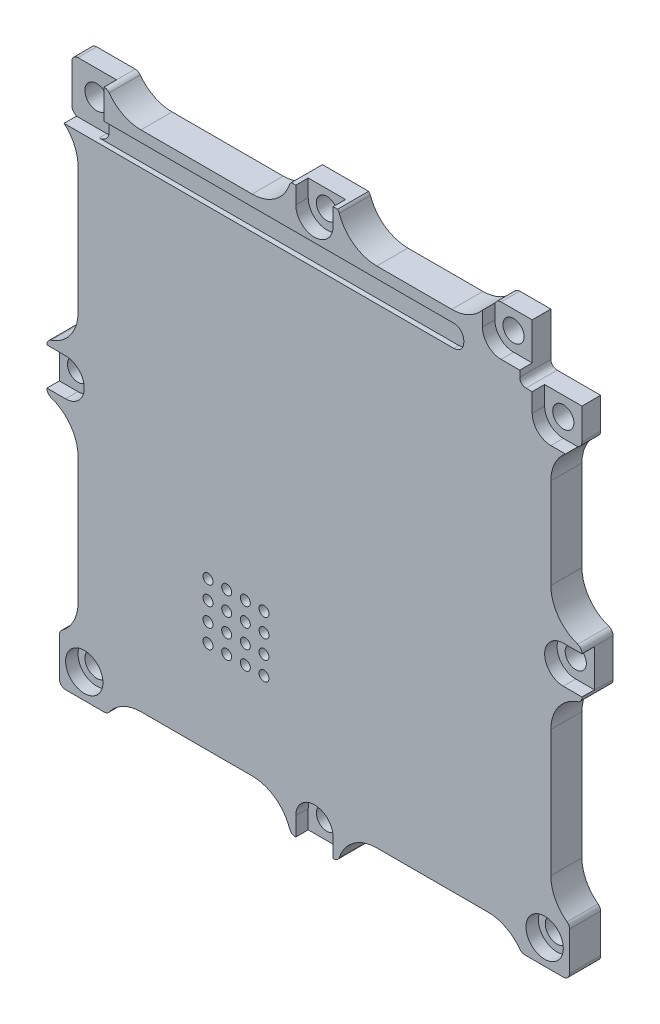
from build123d import *

# Parameters (mm, degrees)
SKETCH1_R           = 1.7
BOSS_EXTRUDE1_DEPTH = 5
CUT_EXTRUDE1_DEPTH  = 2
SKETCH3_R           = 3
CUT_EXTRUDE2_DEPTH  = 2
SKETCH4_R           = 1.9
CUT_EXTRUDE3_DEPTH  = 3
SKETCH5_R           = 0.8
CUT_EXTRUDE4_DEPTH  = 3
CUT_EXTRUDE8_DEPTH  = 0.8
FILLET1_R           = 1.5875
CUT_EXTRUDE9_REACH  = 64.803
SKETCH8_W           = 7.193942136
SKETCH8_H           = 8.27
FILLET2_R           = 1.5875
SKETCH9_W           = 5
SKETCH9_H           = 0.25
CUT_EXTRUDE11_DEPTH = 5


with BuildPart() as part:
    # Sketch1 → Boss-Extrude1 (new body)
    with BuildSketch(Plane.XY):
        with BuildLine():
            Line((43, -3.052490593), (43, 3.052490593))
            ThreePointArc((43, 3.052490593), (42.8123201, 3.635702437), (42.319727891, 4))
            ThreePointArc((42.319727891, 4), (39.191767362, 6.313289526), (38, 10.016684732))
            Line((38, 10.016684732), (38, 24.575474703))
            ThreePointArc((38, 24.575474703), (38.684894673, 27.444112294), (40.591836735, 29.693942136))
            ThreePointArc((40.591836735, 29.693942136), (40.892142571, 30.048246049), (41, 30.5))
            Line((41, 30.5), (41, 35.5))
            Line((41, 35.5), (34, 35.5))
            ThreePointArc((34, 35.5), (33.292893219, 35.792893219), (33, 36.5))
            Line((33, 36.5), (33, 43.5))
            Line((33, 43.5), (28, 43.5))
            ThreePointArc((28, 43.5), (27.548246049, 43.392142571), (27.193942136, 43.091836735))
            ThreePointArc((27.193942136, 43.091836735), (24.944112294, 41.184894673), (22.075474703, 40.5))
            Line((22.075474703, 40.5), (10.016684732, 40.5))
            ThreePointArc((10.016684732, 40.5), (6.313289526, 41.691767362), (4, 44.819727891))
            ThreePointArc((4, 44.819727891), (3.635702437, 45.3123201), (3.052490593, 45.5))
            Line((3.052490593, 45.5), (-3.052490593, 45.5))
            ThreePointArc((-3.052490593, 45.5), (-3.635702437, 45.3123201), (-4, 44.819727891))
            ThreePointArc((-4, 44.819727891), (-6.313289526, 41.691767362), (-10.016684732, 40.5))
            Line((-10.016684732, 40.5), (-27.881532566, 40.5))
            ThreePointArc((-27.881532566, 40.5), (-30.750170158, 41.184894673), (-33, 43.091836735))
            ThreePointArc((-33, 43.091836735), (-33.354303912, 43.392142571), (-33.806057864, 43.5))
            Line((-33.806057864, 43.5), (-40, 43.5))
            ThreePointArc((-40, 43.5), (-40.707106781, 43.207106781), (-41, 42.5))
            Line((-41, 42.5), (-41, 36.306057864))
            ThreePointArc((-41, 36.306057864), (-40.892142571, 35.854303912), (-40.591836735, 35.5))
            ThreePointArc((-40.591836735, 35.5), (-38.684894673, 33.250170158), (-38, 30.381532566))
            Line((-38, 30.381532566), (-38, 10.016684732))
            ThreePointArc((-38, 10.016684732), (-39.191767362, 6.313289526), (-42.319727891, 4))
            ThreePointArc((-42.319727891, 4), (-42.8123201, 3.635702437), (-43, 3.052490593))
            Line((-43, 3.052490593), (-43, -3.052490593))
            ThreePointArc((-43, -3.052490593), (-42.8123201, -3.635702437), (-42.319727891, -4))
            ThreePointArc((-42.319727891, -4), (-39.191767362, -6.313289526), (-38, -10.016684732))
            Line((-38, -10.016684732), (-38, -30.381532566))
            ThreePointArc((-38, -30.381532566), (-38.684894673, -33.250170158), (-40.591836735, -35.5))
            ThreePointArc((-40.591836735, -35.5), (-40.892142571, -35.854303912), (-41, -36.306057864))
            Line((-41, -36.306057864), (-41, -42.5))
            ThreePointArc((-41, -42.5), (-40.707106781, -43.207106781), (-40, -43.5))
            Line((-40, -43.5), (-33.806057864, -43.5))
            ThreePointArc((-33.806057864, -43.5), (-33.354303912, -43.392142571), (-33, -43.091836735))
            ThreePointArc((-33, -43.091836735), (-30.750170158, -41.184894673), (-27.881532566, -40.5))
            Line((-27.881532566, -40.5), (-10.016684732, -40.5))
            ThreePointArc((-10.016684732, -40.5), (-6.313289526, -41.691767362), (-4, -44.819727891))
            ThreePointArc((-4, -44.819727891), (-3.635702437, -45.3123201), (-3.052490593, -45.5))
            Line((-3.052490593, -45.5), (3.052490593, -45.5))
            ThreePointArc((3.052490593, -45.5), (3.635702437, -45.3123201), (4, -44.819727891))
            ThreePointArc((4, -44.819727891), (6.313289526, -41.691767362), (10.016684732, -40.5))
            Line((10.016684732, -40.5), (27.881532566, -40.5))
            ThreePointArc((27.881532566, -40.5), (30.750170158, -41.184894673), (33, -43.091836735))
            ThreePointArc((33, -43.091836735), (33.354303912, -43.392142571), (33.806057864, -43.5))
            Line((33.806057864, -43.5), (40, -43.5))
            ThreePointArc((40, -43.5), (40.707106781, -43.207106781), (41, -42.5))
            Line((41, -42.5), (41, -36.306057864))
            ThreePointArc((41, -36.306057864), (40.892142571, -35.854303912), (40.591836735, -35.5))
            ThreePointArc((40.591836735, -35.5), (38.684894673, -33.250170158), (38, -30.381532566))
            Line((38, -30.381532566), (38, -10.016684732))
            ThreePointArc((38, -10.016684732), (39.191767362, -6.313289526), (42.319727891, -4))
            ThreePointArc((42.319727891, -4), (42.8123201, -3.635702437), (43, -3.052490593))
        make_face()
        with Locations((0, -42.5)):
            Circle(SKETCH1_R, mode=Mode.SUBTRACT)
        with Locations((-40, 0)):
            Circle(SKETCH1_R, mode=Mode.SUBTRACT)
        with Locations((40, 0)):
            Circle(SKETCH1_R, mode=Mode.SUBTRACT)
        with Locations((0, 42.5)):
            Circle(SKETCH1_R, mode=Mode.SUBTRACT)
        with Locations((38, 32.5)):
            Circle(SKETCH1_R, mode=Mode.SUBTRACT)
        with Locations((30, 40.5)):
            Circle(SKETCH1_R, mode=Mode.SUBTRACT)
    extrude(amount=-BOSS_EXTRUDE1_DEPTH)

    # Sketch2 → Cut-Extrude1 (cut)
    with BuildSketch(Plane(origin=(0, 0, -5), x_dir=(-1, 0, 0), z_dir=(0, 0, -1))):
        with BuildLine():
            Line((-20, 37.5), (20, 37.5))
            ThreePointArc((20, 37.5), (30.606601718, 33.106601718), (35, 22.5))
            Line((35, 22.5), (35, -22.5))
            ThreePointArc((35, -22.5), (30.606601718, -33.106601718), (20, -37.5))
            Line((20, -37.5), (-20, -37.5))
            ThreePointArc((-20, -37.5), (-30.606601718, -33.106601718), (-35, -22.5))
            Line((-35, -22.5), (-35, 22.5))
            ThreePointArc((-35, 22.5), (-30.606601718, 33.106601718), (-20, 37.5))
        make_face()
    extrude(amount=-CUT_EXTRUDE1_DEPTH, mode=Mode.SUBTRACT)

    # Sketch3 → Cut-Extrude2 (cut)
    with BuildSketch(Plane.XY):
        with Locations((-37, 39.5)):
            Circle(SKETCH3_R)
        with Locations((-37, -39.5)):
            Circle(SKETCH3_R)
        with Locations((37, -39.5)):
            Circle(SKETCH3_R)
        with BuildLine():
            Line((40, 3), (43, 3))
            Line((43, 3), (43, -3))
            Line((43, -3), (40, -3))
            ThreePointArc((40, -3), (37, 0), (40, 3))
        make_face()
        with BuildLine():
            Line((-40, 3), (-43, 3))
            Line((-43, 3), (-43, -3))
            Line((-43, -3), (-40, -3))
            ThreePointArc((-40, -3), (-37, 0), (-40, 3))
        make_face()
        with BuildLine():
            Line((-3, 42.5), (-3, 45.5))
            Line((-3, 45.5), (3, 45.5))
            Line((3, 45.5), (3, 42.5))
            ThreePointArc((3, 42.5), (0, 39.5), (-3, 42.5))
        make_face()
        with BuildLine():
            Line((-3, -42.5), (-3, -45.5))
            Line((-3, -45.5), (3, -45.5))
            Line((3, -45.5), (3, -42.5))
            ThreePointArc((3, -42.5), (0, -39.5), (-3, -42.5))
        make_face()
        with BuildLine():
            Line((38, 29.5), (40.341066152, 29.5))
            ThreePointArc((40.341066152, 29.5), (40.465240963, 29.598536241), (40.591836735, 29.693942136))
            ThreePointArc((40.591836735, 29.693942136), (40.892142571, 30.048246049), (41, 30.5))
            Line((41, 30.5), (41, 35.5))
            Line((41, 35.5), (35, 35.5))
            Line((35, 35.5), (35, 32.5))
            ThreePointArc((35, 32.5), (35.878679656, 30.378679656), (38, 29.5))
        make_face()
        with BuildLine():
            Line((30, 37.5), (33, 37.5))
            Line((33, 37.5), (33, 43.5))
            Line((33, 43.5), (28, 43.5))
            ThreePointArc((28, 43.5), (27.548246049, 43.392142571), (27.193942136, 43.091836735))
            ThreePointArc((27.193942136, 43.091836735), (27.098536241, 42.965240963), (27, 42.841066152))
            Line((27, 42.841066152), (27, 40.5))
            ThreePointArc((27, 40.5), (27.878679656, 38.378679656), (30, 37.5))
        make_face()
    extrude(amount=-CUT_EXTRUDE2_DEPTH, mode=Mode.SUBTRACT)

    # Sketch4 → Cut-Extrude3 (cut)
    with BuildSketch(Plane.XY.offset(-2)):
        with Locations((-37, 39.5)):
            Circle(SKETCH4_R)
        with Locations((37, -39.5)):
            Circle(SKETCH4_R)
        with Locations((-37, -39.5)):
            Circle(SKETCH4_R)
    extrude(amount=-CUT_EXTRUDE3_DEPTH, mode=Mode.SUBTRACT)

    # Sketch5 → Cut-Extrude4 (cut)
    with BuildSketch(Plane.XY):
        with Locations((-17.109, -19.609)):
            Circle(SKETCH5_R)
        with Locations((-14.109, -19.609)):
            Circle(SKETCH5_R)
        with Locations((-11.109, -19.609)):
            Circle(SKETCH5_R)
        with Locations((-8.109, -19.609)):
            Circle(SKETCH5_R)
        with Locations((-17.109, -22.609)):
            Circle(SKETCH5_R)
        with Locations((-14.109, -22.609)):
            Circle(SKETCH5_R)
        with Locations((-11.109, -22.609)):
            Circle(SKETCH5_R)
        with Locations((-8.109, -22.609)):
            Circle(SKETCH5_R)
        with Locations((-17.109, -25.609)):
            Circle(SKETCH5_R)
        with Locations((-14.109, -25.609)):
            Circle(SKETCH5_R)
        with Locations((-11.109, -25.609)):
            Circle(SKETCH5_R)
        with Locations((-8.109, -25.609)):
            Circle(SKETCH5_R)
        with Locations((-17.109, -16.609)):
            Circle(SKETCH5_R)
        with Locations((-14.109, -16.609)):
            Circle(SKETCH5_R)
        with Locations((-11.109, -16.609)):
            Circle(SKETCH5_R)
        with Locations((-8.109, -16.609)):
            Circle(SKETCH5_R)
    extrude(amount=-CUT_EXTRUDE4_DEPTH, mode=Mode.SUBTRACT)

    # Sketch7 → Cut-Extrude8 (cut)
    with BuildSketch(Plane.XY):
        with BuildLine():
            Line((22.4125, 38.73), (-34.100500043, 38.73))
            ThreePointArc((-34.100500043, 38.73), (-35.171065884, 37.12197561), (-37, 36.5))
            Line((-37, 36.5), (-37, 35.23))
            Line((-37, 35.23), (22.4125, 35.23))
            ThreePointArc((22.4125, 35.23), (23.535032015, 35.694967985), (24, 36.8175))
            Line((24, 36.8175), (24, 37.1425))
            ThreePointArc((24, 37.1425), (23.535032015, 38.265032015), (22.4125, 38.73))
        make_face()
    extrude(amount=-CUT_EXTRUDE8_DEPTH, mode=Mode.SUBTRACT)

    # Fillet1
    # the kernel refuses this fillet: 1.5875 mm, written as the material it adds along each edge
    with BuildSketch(Plane(origin=(-37, 35.23, 0), x_dir=(1.4714388937389554e-12, 1.0, 0), z_dir=(0, 0, -1))) as fillet1_piece_1:
        with BuildLine():
            CenterArc((1.5875, 1.555425987), FILLET1_R, 180, 78.463040967)
            Line((0, 1.555425987), (-0.03175, 1.555425987))
            Line((-0.03175, 1.555425987), (-0.03175, 0))
            Line((-0.03175, 0), (0, -0.03175))
            ThreePointArc((0, -0.03175), (0.635, -0.03175), (1.26365, -0.03110852))
            Line((1.26365, -0.03110852), (1.27, 0))
        make_face()
    extrude(amount=4.688564967)

    # Cut-Extrude9: up to this face of the body (flat: up to its plane)
    cut_extrude9_end = Plane(part.part.faces().sort_by_distance((-39.915147186, 39.5, -2))[0])
    # Sketch8 → Cut-Extrude9 (cut, up to the picked face)
    with BuildSketch(Plane.XY, mode=Mode.PRIVATE) as cut_extrude9_sk1:
        with Locations((-37.403028932, 39.365)):
            Rectangle(SKETCH8_W, SKETCH8_H)
    cut_extrude9_tool1 = split(extrude(cut_extrude9_sk1.sketch, amount=-CUT_EXTRUDE9_REACH, mode=Mode.PRIVATE), bisect_by=cut_extrude9_end, keep=Keep.BOTH, mode=Mode.PRIVATE)
    add(cut_extrude9_tool1.solids().sort_by(Axis((-37.403029, 39.365, 0), (0, 0, -1)))[0], mode=Mode.SUBTRACT)

    # Fillet2
    fillet2_edges = [part.edges().sort_by_distance(p)[0] for p in [
        (-33.806057864, 35.23, -1.4),
    ]]
    fillet(fillet2_edges, radius=FILLET2_R)

    # Sketch9 → Cut-Extrude11 (cut, symmetric)
    with BuildSketch(Plane(origin=(0, 0, 0), x_dir=(0, 0, -1), z_dir=(1, 0, 0))):
        with Locations((2.5, 45.375)):
            Rectangle(SKETCH9_W, SKETCH9_H)
    extrude(amount=CUT_EXTRUDE11_DEPTH, both=True, mode=Mode.SUBTRACT)


solid = part.part
